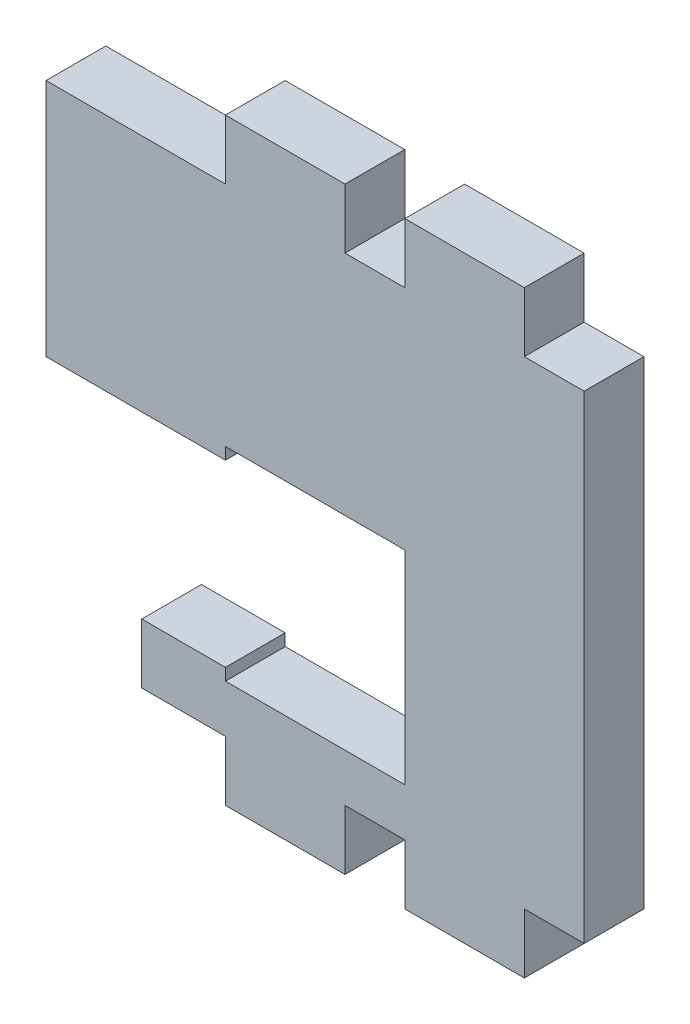
from build123d import *

# Parameters (mm, degrees)
BOSS_EXTRU_1_DEPTH = 5


with BuildPart() as part:
    # Esquisse1 → Boss.-Extru.1 (new body)
    with BuildSketch(Plane.XY):
        Polygon((10, -5), (10, 0), (15, 0), (15, -5), (25, -5), (25, 0), (30, 0), (30, 40), (25, 40), (25, 45), (15, 45), (15, 40), (10, 40), (10, 45), (0, 45), (0, 40), (-15, 40), (-15, 20), (0, 20), (0, 21), (15, 21), (15, 4), (0, 4), (0, 5), (-7, 5), (-7, 0), (0, 0), (0, -5), align=None)
    extrude(amount=BOSS_EXTRU_1_DEPTH)


solid = part.part
